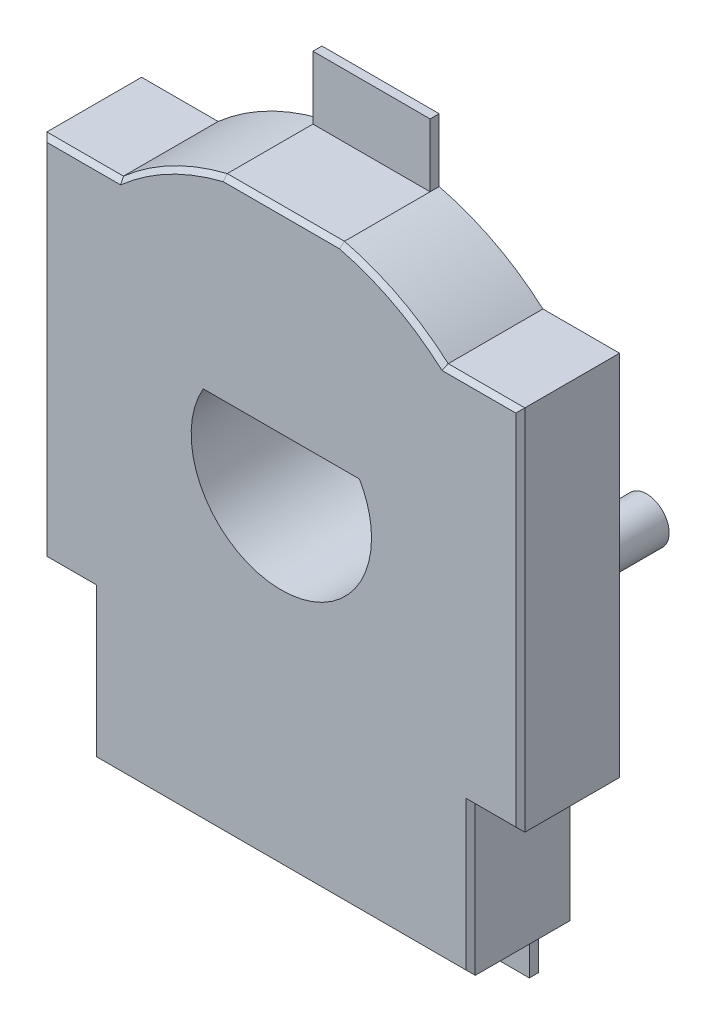
from build123d import *

# Parameters (mm, degrees)
MODEL_R        = 0.5
MODEL_R_2      = 2.5
MODEL_R_3      = 2
EXTRUDE1_DEPTH = 2.2
SKETCH_W       = 1
SKETCH_H       = 1.35
EXTRUDE2_DEPTH = 0.2
SKETCH_2_R     = 2.5
SKETCH_2_R_2   = 2
EXTRUDE3_DEPTH = 0.8
SKETCH_3_R     = 0.5
EXTRUDE4_DEPTH = 1.2
CHAMFER1_SIZE  = 0.1
CHAMFER2_SIZE  = 0.25
CHAMFER3_SIZE  = 0.1
EXTRUDE5_START = -2.2
EXTRUDE5_DEPTH = 2.2


# Read off the part's stored shape, not the designer's step: Extrude5
with BuildPart() as part:
    # Model → Extrude1 (new body)
    # profile 1 of 5: a face of its own
    with BuildSketch(Plane.XY):
        with BuildLine():
            Line((0, 5.3), (-1.3, 5.3))
            ThreePointArc((-1.3, 5.3), (-2.523074038, 4.838811569), (-3.601388621, 4.1))
            Line((-3.601388621, 4.1), (-5.3, 4.1))
            Line((-5.3, 4.1), (-5.3, 0))
            Line((-5.3, 0), (-5.3, -4.05))
            Line((-5.3, -4.05), (-4.2, -4.05))
            Line((-4.2, -4.05), (-4.2, -7.35))
            Line((-4.2, -7.35), (0, -7.35))
            Line((0, -7.35), (4.2, -7.35))
            Line((4.2, -7.35), (4.2, -4.05))
            Line((4.2, -4.05), (5.3, -4.05))
            Line((5.3, -4.05), (5.3, 0))
            Line((5.3, 0), (5.3, 4.1))
            Line((5.3, 4.1), (3.601388621, 4.1))
            ThreePointArc((3.601388621, 4.1), (2.523074038, 4.838811569), (1.3, 5.3))
            Line((1.3, 5.3), (0, 5.3))
        make_face()
        with Locations((4.7, 0)):
            Circle(MODEL_R, mode=Mode.SUBTRACT)
        with Locations((-4.7, 0)):
            Circle(MODEL_R, mode=Mode.SUBTRACT)
        Circle(MODEL_R_2, mode=Mode.SUBTRACT)
    # profile 2 of 5: a face of its own
    with BuildSketch(Plane.XY):
        with Locations((-4.7, 0)):
            Circle(MODEL_R)
    # profile 3 of 5: a face of its own
    with BuildSketch(Plane.XY):
        with Locations((4.7, 0)):
            Circle(MODEL_R)
    # profile 4 of 5: a face of its own
    with BuildSketch(Plane.XY):
        Circle(MODEL_R_2)
        Circle(MODEL_R_3, mode=Mode.SUBTRACT)
    # profile 5 of 5: a face of its own
    with BuildSketch(Plane.XY):
        Circle(MODEL_R_3)
    extrude(amount=EXTRUDE1_DEPTH)

    # Sketch → Extrude2 (add)
    with BuildSketch(Plane.XY):
        Polygon((0, 6.7), (-1.3, 6.7), (-1.3, 5.3), (0, 5.3), (1.3, 5.3), (1.3, 6.7), align=None)
        with Locations((-2, -8.025)):
            Rectangle(SKETCH_W, SKETCH_H)
        with Locations((-3, -8.025)):
            Rectangle(SKETCH_W, SKETCH_H)
        Polygon((1, -8.7), (1, -7.35), (0, -7.35), (-1, -7.35), (-1, -8.7), (0, -8.7), align=None)
        with Locations((2, -8.025)):
            Rectangle(SKETCH_W, SKETCH_H)
        with Locations((3, -8.025)):
            Rectangle(SKETCH_W, SKETCH_H)
    extrude(amount=EXTRUDE2_DEPTH)

    # Sketch 2 → Extrude3 (add)
    with BuildSketch(Plane.XY):
        Circle(SKETCH_2_R)
        Circle(SKETCH_2_R_2, mode=Mode.SUBTRACT)
    extrude(amount=-EXTRUDE3_DEPTH)

    # Sketch 3 → Extrude4 (add)
    with BuildSketch(Plane.XY):
        with Locations((4.7, 0)):
            Circle(SKETCH_3_R)
        with Locations((-4.7, 0)):
            Circle(SKETCH_3_R)
    extrude(amount=-EXTRUDE4_DEPTH)

    # Chamfer1
    chamfer1_edges = [part.edges().sort_by_distance(p)[0] for p in [
        (-4.450694311, 4.1, 2.2),
        (-5.3, 0.025, 2.2),
        (-4.75, -4.05, 2.2),
        (-4.2, -5.7, 2.2),
        (0, -7.35, 2.2),
        (4.2, -5.7, 2.2),
        (0, 5.3, 2.2),
        (4.75, -4.05, 2.2),
        (5.3, 0.025, 2.2),
        (4.450694311, 4.1, 2.2),
        (2.523074038, 4.838811569, 2.2),
        (-2.523074038, 4.838811569, 2.2),
    ]]
    chamfer(chamfer1_edges, length=CHAMFER1_SIZE)

    # Chamfer2
    chamfer2_edges = [part.edges().sort_by_distance(p)[0] for p in [
        (-2.5, 0, 0),
    ]]
    chamfer(chamfer2_edges, length=CHAMFER2_SIZE)

    # Chamfer3
    chamfer3_edges = [part.edges().sort_by_distance(p)[0] for p in [
        (-2.5, 0, -0.8),
    ]]
    chamfer(chamfer3_edges, length=CHAMFER3_SIZE)

    # Extrude5 outline → Extrude5 (cut)
    with BuildSketch(Plane.XY.offset(2.2).offset(EXTRUDE5_START)):
        with BuildLine():
            ThreePointArc((-1.732050808, 1), (0, -2), (1.732050808, 1))
            Line((1.732050808, 1), (-1.732050808, 1))
        make_face()
    extrude(amount=EXTRUDE5_DEPTH, mode=Mode.SUBTRACT)


solid = part.part
